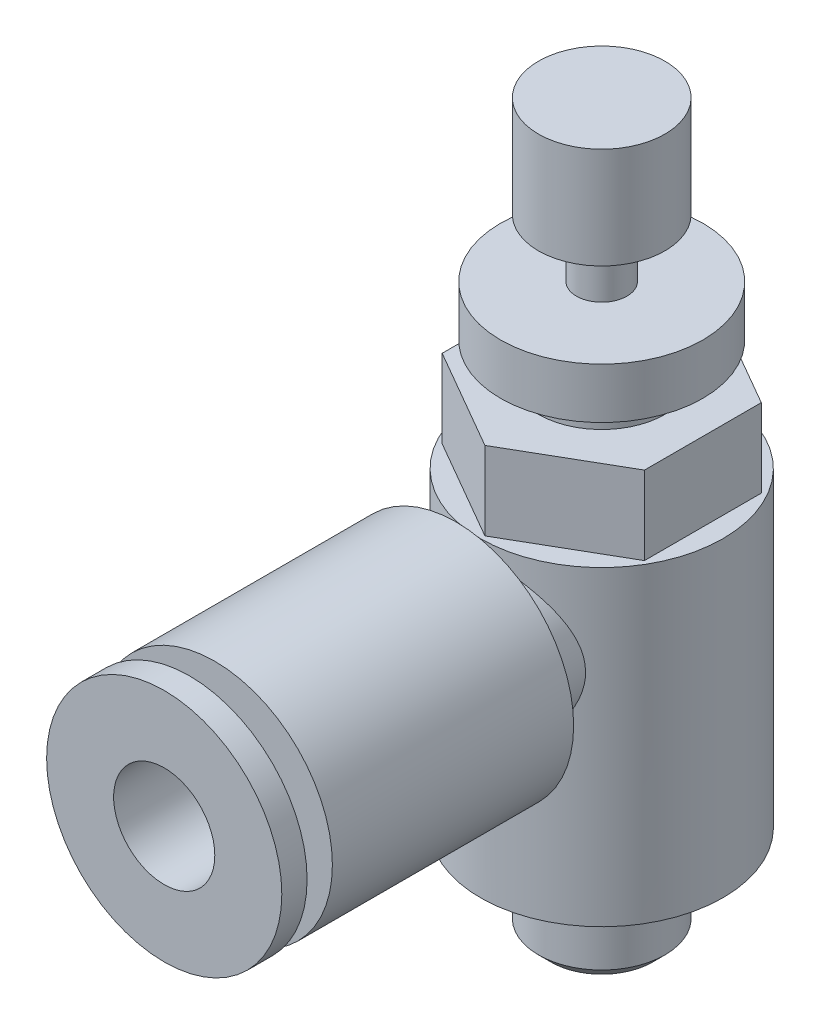
from build123d import *

# Parameters (mm, degrees)
SKETCH_3_R          = 2
CUT_EXTRUDE_1_DEPTH = 12.7
SKETCH_5_R          = 4.8
CUT_EXTRUDE_2_DEPTH = 3.1


with BuildPart() as part:
    # 草图1 → 旋转1 (revolve)
    with BuildSketch(Plane.XY):
        Polygon((0, -3.6), (-2.0095, -3.6), (-2.5, -3.1095), (-2.5, -0.4905), (-2.0095, 0), (-4.8, 0), (-4.8, 12.3), (0, 12.3), align=None)
    revolve(axis=Axis((0, 12.3, 0), (0, -1, 0)))

    # 草图2 → 旋转2 (revolve)
    with BuildSketch(Plane(origin=(0, 0, 0), x_dir=(0, 0, -1), z_dir=(1, 0, 0))):
        Polygon((-17.3, 8.7), (-17.3, 13.35), (-16.3, 13.35), (-16.3, 11.7), (-15.3, 11.7), (-15.3, 13.35), (-5.76, 13.35), (-5.76, 11.76), (0, 11.76), (0, 8.7), align=None)
    revolve(axis=Axis((0, 8.7, 0), (0, 0, 1)))

    # 草图3 → 切除-拉伸1 (cut)
    with BuildSketch(Plane.XY.offset(17.3)):
        with Locations((0, 8.7)):
            Circle(SKETCH_3_R)
    extrude(amount=-CUT_EXTRUDE_1_DEPTH, mode=Mode.SUBTRACT)

    # 草图4 → 旋转3 (revolve)
    with BuildSketch(Plane.XY):
        Polygon((0, 25), (2.5, 25), (2.5, 21), (1, 21), (1, 18.7), (4, 18.7), (4, 16.7), (2.5, 16.7), (2.5, 15.4), (4.8, 15.4), (4.8, 12.3), (0, 12.3), align=None)
    revolve(axis=Axis((0, 12.3, 0), (0, 1, 0)))

    # 草图5 → 切除-拉伸2 (cut)
    with BuildSketch(Plane(origin=(0, 12.3, 0), x_dir=(-1, 0, 0), z_dir=(0, 1, 0))):
        Circle(SKETCH_5_R)
        Polygon((4, -2.309401077), (4, 2.309401077), (0, 4.618802154), (-4, 2.309401077), (-4, -2.309401077), (0, -4.618802154), align=None, mode=Mode.SUBTRACT)
    extrude(amount=CUT_EXTRUDE_2_DEPTH, mode=Mode.SUBTRACT)


solid = part.part
